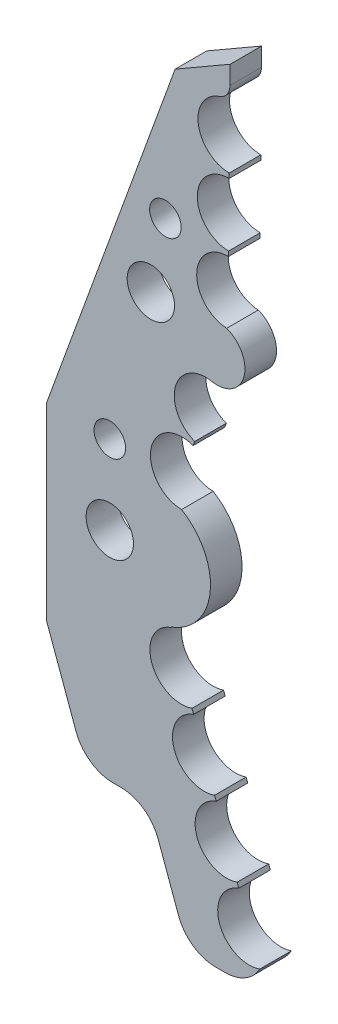
from build123d import *

# Parameters (mm, degrees)
BOSS_EXTRU_2_DEPTH      = 2
CONG_1_R                = 1
ESQUISSE2_R             = 1
ESQUISSE2_R_2           = 1.5
ENL_V_MAT_EXTRU_1_DEPTH = 50.654670275
CONG_2_R                = 2.5


with BuildPart() as part:
    # Esquisse1 → Boss.-Extru.2 (new body)
    with BuildSketch(Plane.XY):
        with BuildLine():
            Line((0.95447274, 5.745584386), (3.449873287, -1.110472271))
            Line((3.449873287, -1.110472271), (8.449873287, -1.110472271))
            Line((8.449873287, -1.110472271), (7.995996013, 0.174830759))
            ThreePointArc((7.995996013, 0.174830759), (5.44417176, 1.394745914), (6.664086914, 3.946570166))
            Line((6.664086914, 3.946570166), (6.564193732, 4.229450622))
            ThreePointArc((6.564193732, 4.229450622), (4.012369479, 5.449365776), (5.232284634, 8.001190029))
            Line((5.232284634, 8.001190029), (5.132391451, 8.284070484))
            ThreePointArc((5.132391451, 8.284070484), (2.580567198, 9.503985638), (3.800482353, 12.055809891))
            Line((3.800482353, 12.055809891), (3.70058917, 12.338690347))
            ThreePointArc((3.70058917, 12.338690347), (1.148764918, 13.558605501), (2.368680072, 16.110429753))
            Line((2.368680072, 16.110429753), (2.360851147, 16.132599934))
            ThreePointArc((2.360851147, 16.132599934), (4.854316205, 19.307619995), (3.042318195, 22.915220804))
            ThreePointArc((3.042318195, 22.915220804), (1.102078927, 25.284293174), (3.769763015, 26.787787077))
            Line((3.769763015, 26.787787077), (3.87507245, 27.068696178))
            ThreePointArc((3.87507245, 27.068696178), (2.663964414, 29.524327439), (5.038572788, 30.887464495))
            ThreePointArc((5.038572788, 30.887464495), (7.001105436, 32.201717881), (5.901338085, 34.292006887))
            ThreePointArc((5.901338085, 34.292006887), (3.997941168, 36.347217372), (6.01632714, 38.289620015))
            Line((6.01632714, 38.289620015), (6.019210973, 38.589804586))
            ThreePointArc((6.019210973, 38.589804586), (4.038516109, 40.608925151), (6.057636674, 42.589620015))
            Line((6.057636674, 42.589620015), (6.060520508, 42.889804586))
            ThreePointArc((6.060520508, 42.889804586), (4.079825644, 44.908925151), (6.098946209, 46.889620015))
            Line((6.098946209, 46.889620015), (6.11815906, 48.889527729))
            Line((6.11815906, 48.889527729), (2.631980822, 46.876781785))
            Line((2.631980822, 46.876781785), (-5.50821759, 24.511770458))
            Line((-5.50821759, 24.511770458), (-5.50821759, 12.511770458))
            Line((-5.50821759, 12.511770458), (-3.04552726, 5.745584386))
            Line((-3.04552726, 5.745584386), (0.95447274, 5.745584386))
        make_face()
    extrude(amount=BOSS_EXTRU_2_DEPTH)

    # Congé1
    cong_1_edges = [part.edges().sort_by_distance(p)[0] for p in [
        (6.098946209, 46.889620015, 1),
    ]]
    fillet(cong_1_edges, radius=CONG_1_R)

    # Esquisse2 → Enlèv. mat.-Extru.1 (cut, through all)
    with BuildSketch(Plane.XY.offset(2)):
        with Locations((2.016979912, 38.376781785)):
            Circle(ESQUISSE2_R)
        with Locations((1.092901094, 33.876781785)):
            Circle(ESQUISSE2_R_2)
        with Locations((-1.50821759, 19.511770458)):
            Circle(ESQUISSE2_R_2)
        with Locations((-1.50821759, 24.511770458)):
            Circle(ESQUISSE2_R)
    extrude(amount=-ENL_V_MAT_EXTRU_1_DEPTH, mode=Mode.SUBTRACT)

    # Congé2
    # the kernel refuses this fillet: 2.5 mm, written as the material it adds along each edge
    with BuildSketch(Plane(origin=(0.95447274, 5.745584386, 0), x_dir=(-1, 0, 0), z_dir=(0, 0, 1))) as cong_2_piece_1:
        with BuildLine():
            CenterArc((CONG_2_R * 0.70020753821, CONG_2_R), CONG_2_R, 200, 70)
            Line((-CONG_2_R * 0.239485082576, CONG_2_R * 0.657979856674), (0, 0))
            Line((0, 0), (CONG_2_R * 0.70020753821, 0))
        make_face()
    extrude(amount=2)
    # the kernel refuses this fillet: 2.5 mm, written as the material it takes off along each edge
    with BuildSketch(Plane(origin=(8.449873287, -1.110472271, -6.597356953), x_dir=(-1, 0, 0), z_dir=(0, 0, 1))) as cong_2_2_piece_1:
        with BuildLine():
            CenterArc((2.638942781, -2.5), CONG_2_R, 90, 60.929935742)
            Line((0.453877274, -1.28530303), (0, 0))
            Line((0, 0), (2.638942781, 0))
        make_face()
    extrude(amount=15.194713907, mode=Mode.SUBTRACT)
    with BuildSketch(Plane(origin=(3.449873287, -1.110472271, -4.376297114), x_dir=(-0.3420201433256723, 0.9396926207859071, 0), z_dir=(0, 0, 1)), Plane(origin=(-3.04552726, 5.745584386, -4.376297114), x_dir=(-0.34202014332566605, 0.9396926207859094, 0), z_dir=(0, 0, 1))) as cong_2_2_piece_2:
        with BuildLine():
            CenterArc((CONG_2_R * 0.70020753821, -CONG_2_R), CONG_2_R, 90, 70)
            Line((-CONG_2_R * 0.239485082576, -CONG_2_R * 0.657979856674), (0, 0))
            Line((0, 0), (CONG_2_R * 0.70020753821, 0))
        make_face()
    extrude(amount=10.752594228, mode=Mode.SUBTRACT)


solid = part.part
